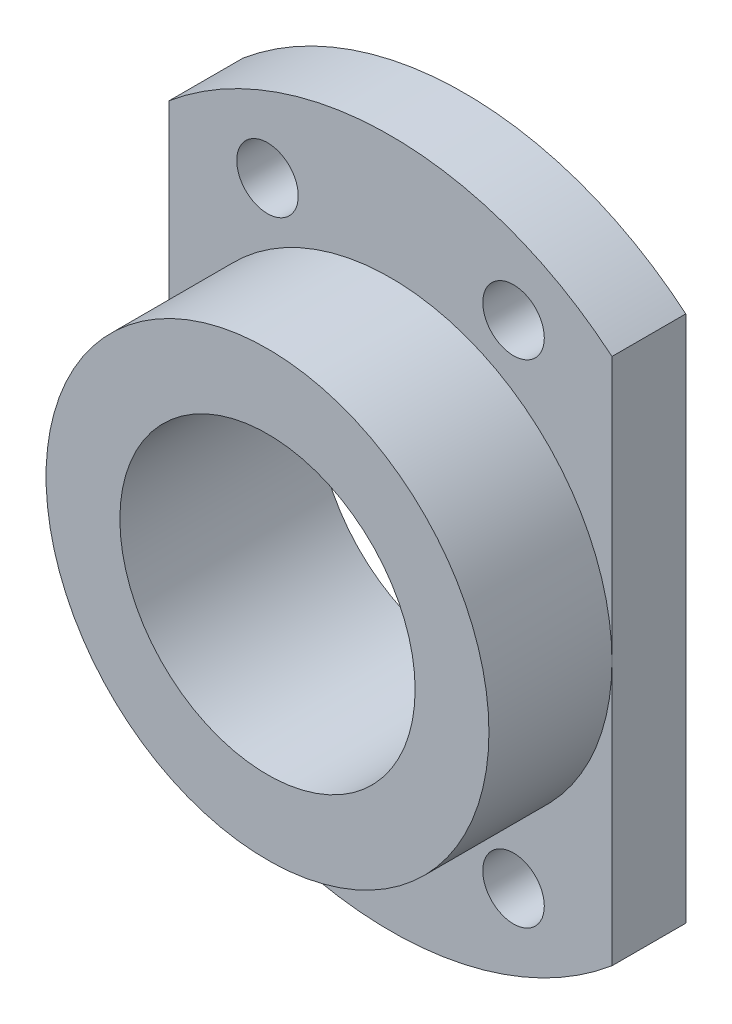
from build123d import *

# Parameters (mm, degrees)
SKETCH1_R               = 6
SKETCH1_R_2             = 1.25
BOSS_EXTRUDE1_DEPTH     = 3
SKETCH2_R               = 9
SKETCH2_R_2             = 6
LINEARBALLSUPPORT_DEPTH = 5


with BuildPart() as part:
    # Sketch1 → Boss-Extrude1 (new body)
    with BuildSketch(Plane.XY):
        with BuildLine():
            Line((-9, 10.723805295), (-9, -10.723805295))
            ThreePointArc((-9, -10.723805295), (0, -14), (9, -10.723805295))
            Line((9, -10.723805295), (9, 10.723805295))
            ThreePointArc((9, 10.723805295), (0, 14), (-9, 10.723805295))
        make_face()
        Circle(SKETCH1_R, mode=Mode.SUBTRACT)
        with Locations((-5, 10)):
            Circle(SKETCH1_R_2, mode=Mode.SUBTRACT)
        with Locations((5, 10)):
            Circle(SKETCH1_R_2, mode=Mode.SUBTRACT)
        with Locations((-5, -10)):
            Circle(SKETCH1_R_2, mode=Mode.SUBTRACT)
        with Locations((5, -10)):
            Circle(SKETCH1_R_2, mode=Mode.SUBTRACT)
    extrude(amount=BOSS_EXTRUDE1_DEPTH)

    # Sketch2 → LinearBallSupport (add)
    with BuildSketch(Plane.XY.offset(3)):
        Circle(SKETCH2_R)
        Circle(SKETCH2_R_2, mode=Mode.SUBTRACT)
    extrude(amount=LINEARBALLSUPPORT_DEPTH)


solid = part.part
